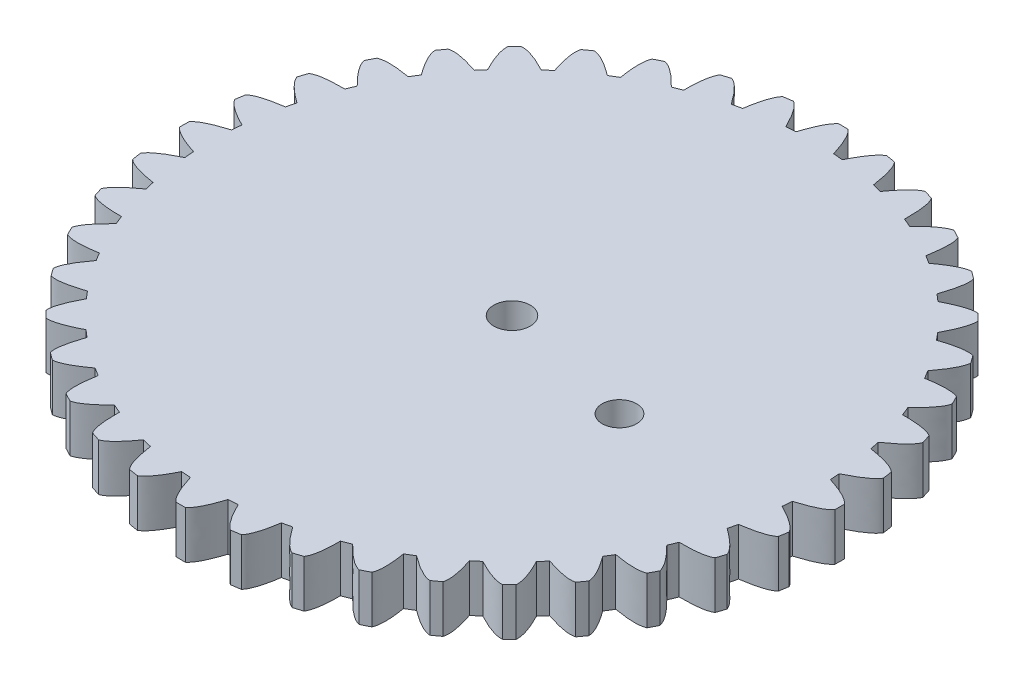
from build123d import *

# Parameters (mm, degrees)
BOSS_EXTRUDE4_DEPTH = 5
CIRPATTERN6_COUNT   = 40
SKETCH2_R           = 1.925
CUT_EXTRUDE2_DEPTH  = 10
SKETCH4_R           = 1.825
CUT_EXTRUDE3_DEPTH  = 10


with BuildPart() as part:
    # Sketch1 → Boss-Extrude4 (new body)
    with BuildSketch(Plane(origin=(0, 0, 0), x_dir=(1, 0, 0), z_dir=(0, 1, 0))):
        with BuildLine():
            ThreePointArc((25.074641807, 24.085026475), (24.72568284, 24.443133395), (24.371610035, 24.796184915))
            add(Edge.make_bspline(
                [(24.371610035, 24.796184915), (23.418390603, 24.907550547), (21.187068944, 23.755419297)],
                knots=[0.625082285, 0.625082285, 0.625082285, 1, 1, 1], degree=2))
            ThreePointArc((21.187068944, 23.755419297), (-22.636876223, -22.378196337), (23.997346093, 20.91265686))
            add(Edge.make_bspline(
                [(23.997346093, 20.91265686), (25.175045063, 23.130590109), (25.074641807, 24.085026475)],
                knots=[0, 0, 0, 0.374917715, 0.374917715, 0.374917715], degree=2))
        make_face()
    boss_extrude4 = extrude(amount=BOSS_EXTRUDE4_DEPTH)

    # CirPattern6: Boss-Extrude4 ×40 about axis
    cirpattern6_axis = Axis((0, 5, 0), (0, 1, 0))
    for i in range(1, CIRPATTERN6_COUNT):
        add(boss_extrude4.rotate(cirpattern6_axis, i * 360 / CIRPATTERN6_COUNT))

    # Sketch2 → Cut-Extrude2 (cut)
    with BuildSketch(Plane(origin=(0, 5, 0), x_dir=(1, 0, 0), z_dir=(0, 1, 0))):
        Circle(SKETCH2_R)
    extrude(amount=-CUT_EXTRUDE2_DEPTH, mode=Mode.SUBTRACT)

    # Sketch4 → Cut-Extrude3 (cut)
    with BuildSketch(Plane.XZ):
        with Locations((14.633027356, 3.297652254)):
            Circle(SKETCH4_R)
    extrude(amount=-CUT_EXTRUDE3_DEPTH, mode=Mode.SUBTRACT)


solid = part.part
